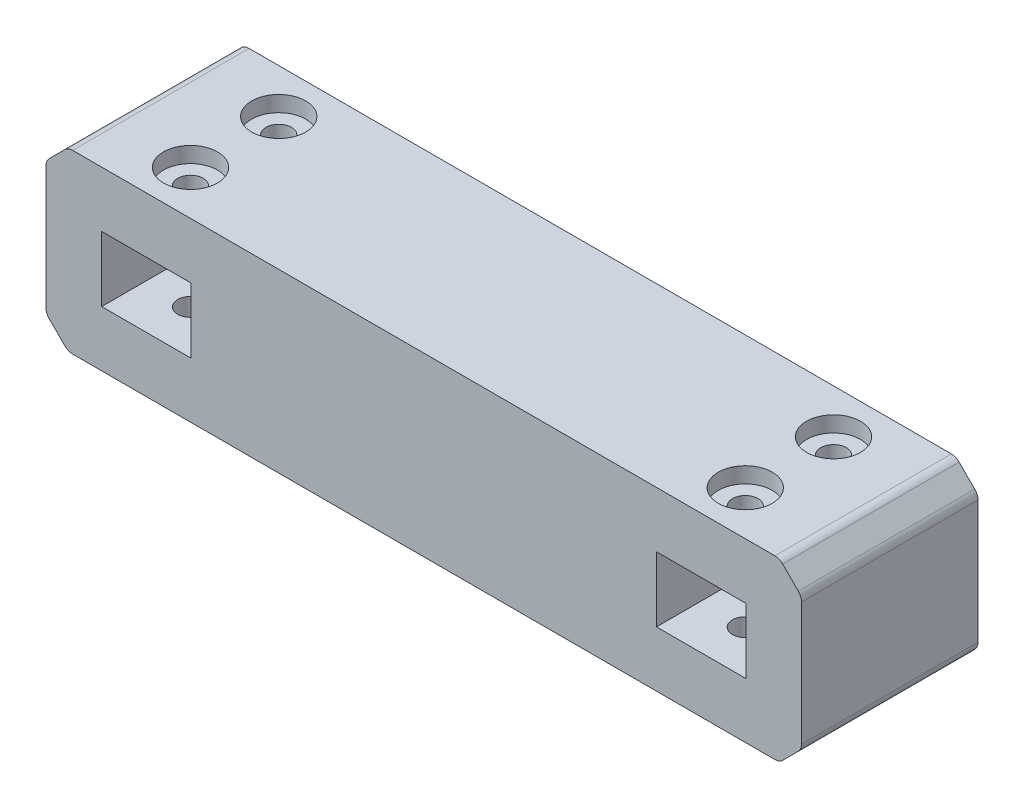
from build123d import *

# Parameters (mm, degrees)
SKETCH2_W                               = 171.25
SKETCH2_H                               = 40
BOSS_EXTRUDE1_DEPTH                     = 40
SKETCH3_W                               = 20.25
SKETCH3_H                               = 14.75
CUT_EXTRUDE1_DEPTH                      = 97.600417313
CHAMFER1_SIZE                           = 5
FILLET1_R                               = 2.5
CBORE_FOR_M5_HEX_HEAD_BOLT1_D           = 5.8
CBORE_FOR_M5_HEX_HEAD_BOLT1_CBORE_D     = 12.24
CBORE_FOR_M5_HEX_HEAD_BOLT1_CBORE_DEPTH = 3.58
MIRROR2_COPY_1_D                        = 5.8
MIRROR2_COPY_1_CBORE_D                  = 12.24
MIRROR2_COPY_1_CBORE_DEPTH              = 3.58


with BuildPart() as part:
    # Sketch2 → Boss-Extrude1 (new body)
    with BuildSketch(Plane.XY):
        Rectangle(SKETCH2_W, SKETCH2_H)
    extrude(amount=BOSS_EXTRUDE1_DEPTH)

    # Sketch3 → Cut-Extrude1 (cut, through all)
    with BuildSketch(Plane.XY.offset(40)):
        with Locations((-62.875, 0)):
            Rectangle(SKETCH3_W, SKETCH3_H)
        with Locations((62.875, 0)):
            Rectangle(SKETCH3_W, SKETCH3_H)
    extrude(amount=-CUT_EXTRUDE1_DEPTH, mode=Mode.SUBTRACT)

    # Chamfer1
    chamfer1_edges = [part.edges().sort_by_distance(p)[0] for p in [
        (85.625, 20, 20),
        (85.625, -20, 20),
        (-85.625, -20, 20),
        (-85.625, 20, 20),
    ]]
    chamfer(chamfer1_edges, length=CHAMFER1_SIZE)

    # Fillet1
    fillet1_edges = [part.edges().sort_by_distance(p)[0] for p in [
        (80.625, 20, 20),
        (85.625, 15, 20),
        (85.625, -15, 20),
        (80.625, -20, 20),
        (-80.625, -20, 20),
        (-85.625, -15, 20),
        (-80.625, 20, 20),
        (-85.625, 15, 20),
    ]]
    fillet(fillet1_edges, radius=FILLET1_R)

    # CBORE for M5 Hex Head Bolt1 (through all)
    with Locations(Plane(origin=(0, 20, 0), x_dir=(1, 0, 0), z_dir=(0, 1, 0))):
        with Locations((-62.875, -10)):
            cbore_for_m5_hex_head_bolt1 = CounterBoreHole(CBORE_FOR_M5_HEX_HEAD_BOLT1_D / 2, CBORE_FOR_M5_HEX_HEAD_BOLT1_CBORE_D / 2, CBORE_FOR_M5_HEX_HEAD_BOLT1_CBORE_DEPTH)

    # Mirror1: CBORE for M5 Hex Head Bolt1 across plane
    add(cbore_for_m5_hex_head_bolt1.mirror(Plane.XY.offset(20)), mode=Mode.SUBTRACT)

    # Mirror2: CBORE for M5 Hex Head Bolt1 across plane
    add(cbore_for_m5_hex_head_bolt1.mirror(Plane(origin=(0, 0, 0), x_dir=(0, 0, 1), z_dir=(1, 0, 0))), mode=Mode.SUBTRACT)

    # Mirror2 copy 1 (through all)
    with Locations(Plane(origin=(0, 20, 40), x_dir=(-1, 0, 0), z_dir=(0, 1, 0))):
        with Locations((-62.875, -10)):
            CounterBoreHole(MIRROR2_COPY_1_D / 2, MIRROR2_COPY_1_CBORE_D / 2, MIRROR2_COPY_1_CBORE_DEPTH)


solid = part.part
